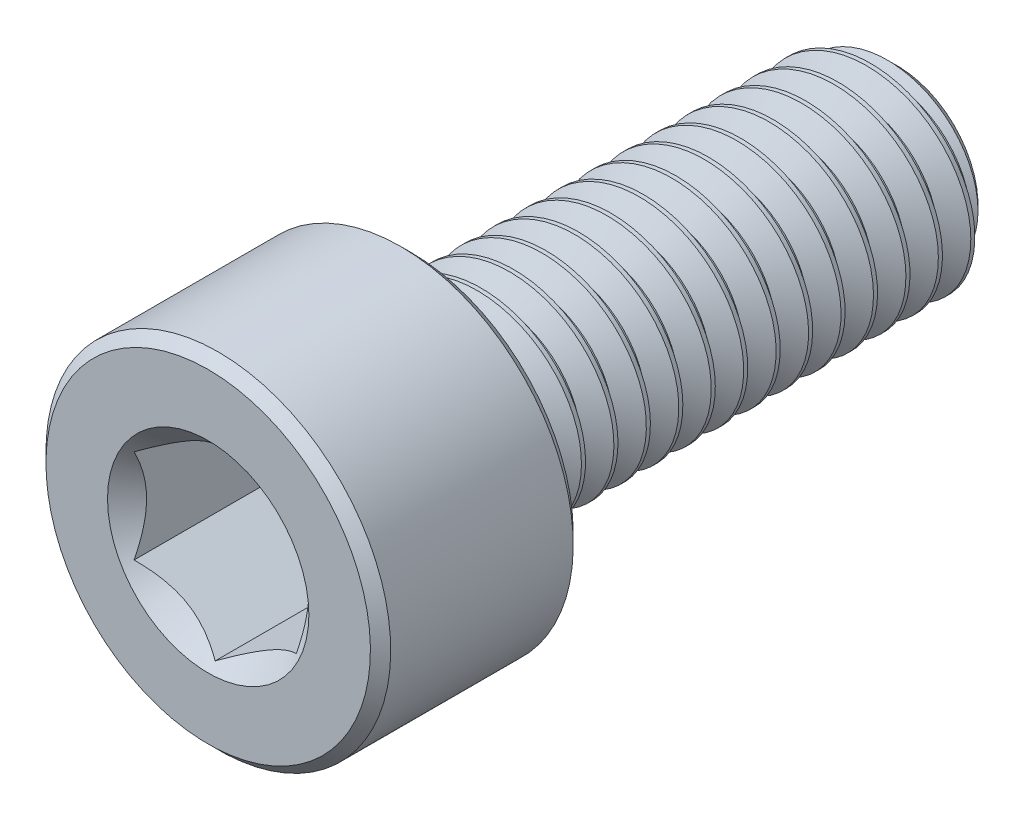
from build123d import *

# Parameters (mm, degrees)
CUT_EXTRUDE1_DEPTH     = 4
SPLIT1_SURFACE_1_BACK  = 21.821
SPLIT1_SURFACE_1_DEPTH = 43.642
SPLIT1_SURFACE_2_BACK  = 21.821
SPLIT1_SURFACE_2_DEPTH = 43.642
CUT_SWEEP1_PITCH       = 0.8
CUT_SWEEP1_TO          = 11.75


with BuildPart() as part:
    # Sketch2 → Revolve1 (revolve)
    with BuildSketch(Plane(origin=(0, 0, 0), x_dir=(0, 0, -1), z_dir=(1, 0, 0))):
        with BuildLine():
            Line((-8.5, 0), (-8.5, 4))
            Line((-8.5, 4), (-8.25, 4.25))
            Line((-8.25, 4.25), (-3.75, 4.25))
            Line((-3.75, 4.25), (-3.5, 4))
            Line((-3.5, 4), (-3.5, 2.75))
            ThreePointArc((-3.5, 2.75), (-3.426776695, 2.573223305), (-3.25, 2.5))
            Line((-3.25, 2.5), (7.980384758, 2.5))
            Line((7.980384758, 2.5), (8.5, 1.980384758))
            Line((8.5, 1.980384758), (8.5, 0))
            Line((8.5, 0), (-8.5, 0))
        make_face()
    revolve(axis=Axis((0, 0, -8.5), (0, 0, 1)))

    # Sketch3 → Cut-Extrude1 (cut)
    with BuildSketch(Plane.XY.offset(8.5)):
        Polygon((2, -1.154700538), (2, 1.154700538), (0, 2.309401077), (-2, 1.154700538), (-2, -1.154700538), (0, -2.309401077), align=None)
    extrude(amount=-CUT_EXTRUDE1_DEPTH, mode=Mode.SUBTRACT)

    # Cut-Extrude2 cone 1 section (through the dimple's axis) → Cut-Extrude2 (revolve, cut)
    with BuildSketch(Plane(origin=(0, 0, 8.5), x_dir=(0, -1, 0), z_dir=(1, 0, 0))):
        Polygon((0, 0), (2.482606158, 0), (0, 2.482606158), align=None)
    revolve(axis=Axis((0, 0, 8.5), (0, 0, -1)), mode=Mode.SUBTRACT)


with BuildPart() as body_2:
    # Split1: the piece behind the surface
    add(part.part)
    # Split1 surface: a surface, the sketch's curves swept straight by 43.642 mm
    with BuildLine(Plane(origin=(0, 0, 0), x_dir=(0, 0, -1), z_dir=(1, 0, 0)).offset(-SPLIT1_SURFACE_1_BACK), mode=Mode.PRIVATE) as split1_surface_1_path:
        Line((-3.25, -4.25), (-3.25, 4.25))
    split1_surface_1 = Shell.extrude(split1_surface_1_path.wire(), (1 * SPLIT1_SURFACE_1_DEPTH, 0 * SPLIT1_SURFACE_1_DEPTH, 0 * SPLIT1_SURFACE_1_DEPTH))
    split(bisect_by=split1_surface_1, keep=Keep.BOTTOM)

    # Cut-Sweep1: arcs per turn and ends read off the stored shape
    # Cut-Sweep1: the profile of Sketch7 screwed along a right-hand helix through 16 turns, 8 arcs to a turn; built about Z, then put on its axis
    cut_sweep1_z = Axis((0, 0, 0), (0, 0, 1))
    cut_sweep1_corners = [(2.54330127, 0, 0.025), (2.54330127, 0, -0.725), (1.980384758, 0, -0.4), (1.980384758, 0, -0.3)]
    with BuildLine(mode=Mode.PRIVATE) as cut_sweep1_profile:
        Line(cut_sweep1_corners[0], cut_sweep1_corners[1])
        Line(cut_sweep1_corners[1], cut_sweep1_corners[2])
        Line(cut_sweep1_corners[2], cut_sweep1_corners[3])
        Line(cut_sweep1_corners[3], cut_sweep1_corners[0])
    cut_sweep1_cap = Face(cut_sweep1_profile.wire())
    cut_sweep1_turn_angles = [0, 22.5, 45, 67.5, 90, 112.5, 135, 157.5, 180, 202.5, 225, 247.5, 270, 292.5, 315, 337.5, 360]
    cut_sweep1_turn_weights = [1, 0.9238795325112867, 1, 0.9238795325112867, 1, 0.9238795325112867, 1, 0.9238795325112867, 1, 0.9238795325112867, 1, 0.9238795325112867, 1, 0.9238795325112867, 1, 0.9238795325112867, 1]
    cut_sweep1_turn_rails = [Edge.make_bspline([Vector(p[0], p[1], 0).rotate(cut_sweep1_z, cut_sweep1_turn_angles[k]) / cut_sweep1_turn_weights[k] + Vector(0, 0, p[2] + CUT_SWEEP1_PITCH * cut_sweep1_turn_angles[k] / 360) for k in range(17)], [0, 0, 0, 1, 1, 2, 2, 3, 3, 4, 4, 5, 5, 6, 6, 7, 7, 8, 8, 8], 2, cut_sweep1_turn_weights) for p in cut_sweep1_corners]
    cut_sweep1_turn_sides = [Face.make_surface_from_curves(cut_sweep1_turn_rails[p[0]], cut_sweep1_turn_rails[p[1]]) for p in [(0, 1), (1, 2), (2, 3), (3, 0)]]
    cut_sweep1 = Plane(origin=(0, 0, -8.5), x_dir=(0, 1, 0), z_dir=(0, 0, 1)) * split(Solid(Shell([*[p.moved(Location((0, 0, CUT_SWEEP1_PITCH * i))) for i in range(16) for p in cut_sweep1_turn_sides], cut_sweep1_cap, cut_sweep1_cap.rotate(cut_sweep1_z, 5760).moved(Location((0, 0, CUT_SWEEP1_PITCH * 5760 / 360)))])), bisect_by=Plane.XY.offset(CUT_SWEEP1_TO), keep=Keep.BOTTOM, mode=Mode.PRIVATE)
    add(cut_sweep1, mode=Mode.SUBTRACT)


with BuildPart() as part_1:
    add(part.part)

    # Split1: split by a surface, the side it looks to stays
    # Split1 surface: a surface, the sketch's curves swept straight by 43.642 mm
    with BuildLine(Plane(origin=(0, 0, 0), x_dir=(0, 0, -1), z_dir=(1, 0, 0)).offset(-SPLIT1_SURFACE_2_BACK), mode=Mode.PRIVATE) as split1_surface_2_path:
        Line((-3.25, -4.25), (-3.25, 4.25))
    split1_surface_2 = Shell.extrude(split1_surface_2_path.wire(), (1 * SPLIT1_SURFACE_2_DEPTH, 0 * SPLIT1_SURFACE_2_DEPTH, 0 * SPLIT1_SURFACE_2_DEPTH))
    split(bisect_by=split1_surface_2, keep=Keep.TOP)

    add(body_2.part)  # Revolve2 merges body 2
    # Sketch8 → Revolve2 (revolve)
    with BuildSketch(Plane(origin=(0, 0, 0), x_dir=(0, 0, -1), z_dir=(1, 0, 0)), mode=Mode.PRIVATE) as revolve2_sk:
        Polygon((-3.5, 0), (-3.5, 2.5), (-3.25, 2.5), (-1.806624327, 0), align=None)
    revolve(revolve2_sk.sketch.rotate(Axis((0, 0, 1.806624327), (0, 0, 1)), 270), axis=Axis((0, 0, 1.806624327), (0, 0, 1)))


solid = part_1.part
